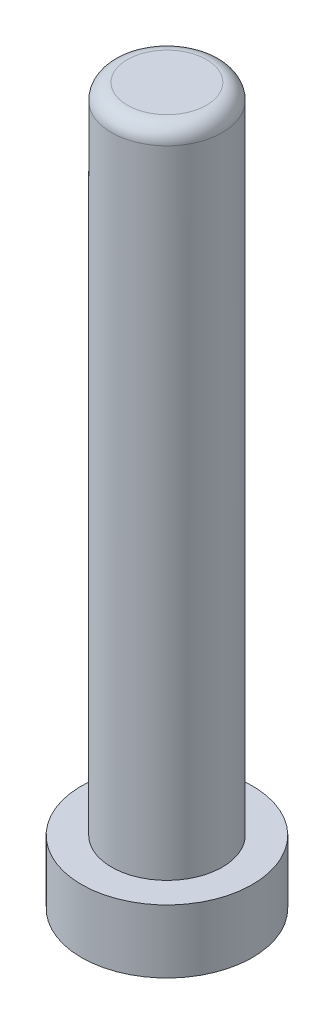
from build123d import *

# Parameters (mm, degrees)
SKETCH1_R           = 2.7
BOSS_EXTRUDE1_DEPTH = 2
SKETCH3_R           = 0.95
CUT_EXTRUDE2_DEPTH  = 9.5
SKETCH2_R           = 1.75
BOSS_EXTRUDE2_DEPTH = 20.6
SKETCH7_R           = 1.2
CUT_EXTRUDE4_DEPTH  = 2.8
FILLET2_R           = 0.5
SKETCH8_R           = 0.95
CUT_EXTRUDE5_DEPTH  = 9.5


with BuildPart() as part:
    # Sketch1 → Boss-Extrude1 (new body)
    with BuildSketch(Plane(origin=(0, 0, 0), x_dir=(1, 0, 0), z_dir=(0, 1, 0))):
        Circle(SKETCH1_R)
    extrude(amount=BOSS_EXTRUDE1_DEPTH)

    # Sketch3 → Cut-Extrude2 (cut)
    with BuildSketch(Plane.XZ):
        Circle(SKETCH3_R)
    extrude(amount=-CUT_EXTRUDE2_DEPTH, mode=Mode.SUBTRACT)

    # Sketch2 → Boss-Extrude2 (add)
    with BuildSketch(Plane(origin=(0, 2, 0), x_dir=(1, 0, 0), z_dir=(0, 1, 0))):
        Circle(SKETCH2_R)
    extrude(amount=BOSS_EXTRUDE2_DEPTH)

    # Sketch7 → Cut-Extrude4 (cut)
    with BuildSketch(Plane.XZ):
        Circle(SKETCH7_R)
    extrude(amount=-CUT_EXTRUDE4_DEPTH, mode=Mode.SUBTRACT)

    # Fillet2
    fillet2_edges = [part.edges().sort_by_distance(p)[0] for p in [
        (-1.75, 22.6, 0),
    ]]
    fillet(fillet2_edges, radius=FILLET2_R)

    # Sketch8 → Cut-Extrude5 (cut)
    with BuildSketch(Plane.XZ):
        Circle(SKETCH8_R)
    extrude(amount=-CUT_EXTRUDE5_DEPTH, mode=Mode.SUBTRACT)


solid = part.part
